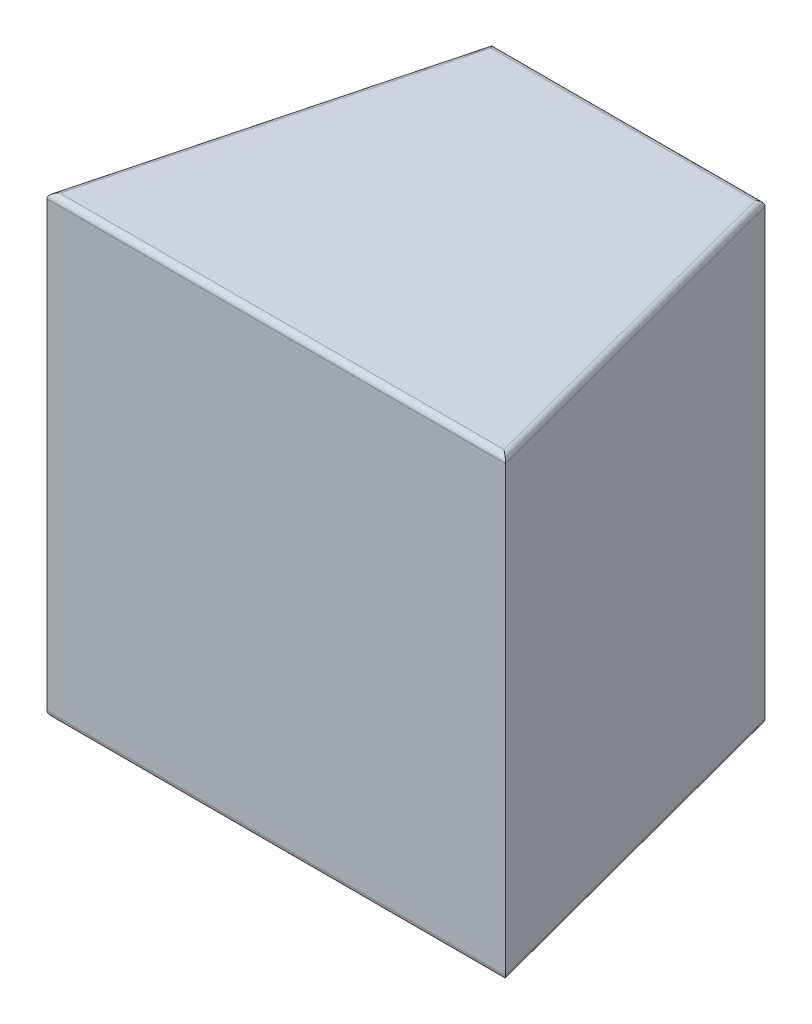
from build123d import *

# Parameters (mm, degrees)
BOSS_EXTRUDE1_DEPTH = 40
FILLET1_R           = 0.5


with BuildPart() as part:
    # Sketch1 → Boss-Extrude1 (new body)
    with BuildSketch(Plane(origin=(0, 0, 0), x_dir=(1, 0, 0), z_dir=(0, 1, 0))):
        Polygon((-20.175, -15.5), (-12, 15.5), (12, 15.5), (20.175, -15.5), align=None)
    extrude(amount=BOSS_EXTRUDE1_DEPTH)

    # Fillet1
    fillet1_edges = [part.edges().sort_by_distance(p)[0] for p in [
        (16.0875, 0, 0),
        (0, 0, -15.5),
        (-16.0875, 0, 0),
        (0, 0, 15.5),
        (-16.0875, 40, 0),
        (0, 40, -15.5),
        (16.0875, 40, 0),
        (0, 40, 15.5),
    ]]
    fillet(fillet1_edges, radius=FILLET1_R)


solid = part.part
